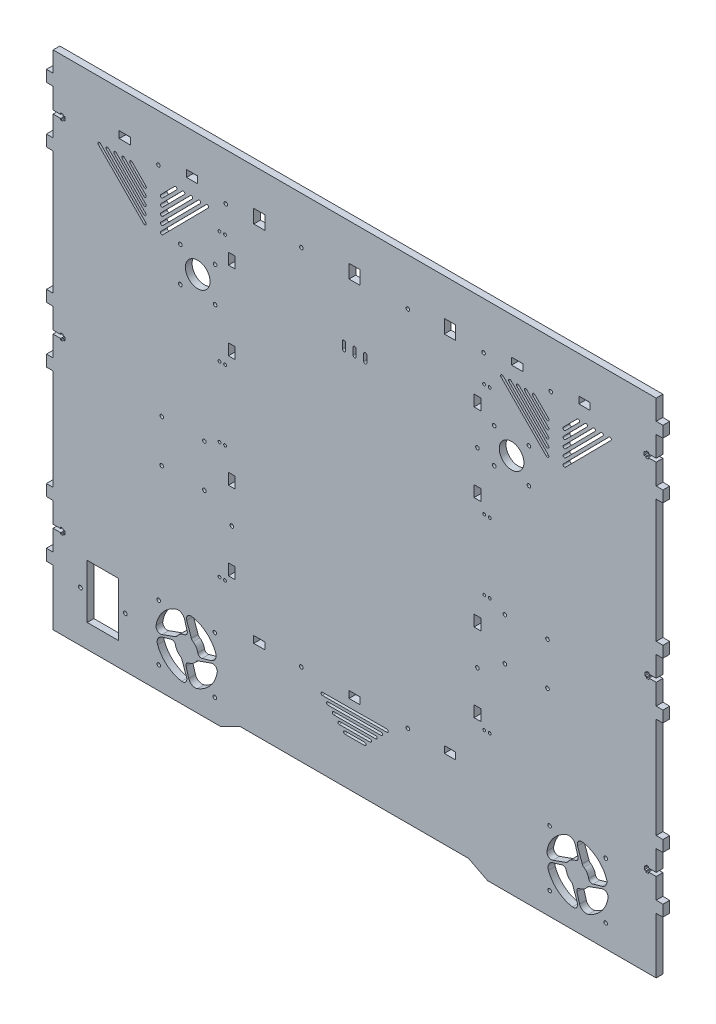
from build123d import *

# Parameters (mm, degrees)
SKETCH_1_R      = 1.6
SKETCH_1_R_2    = 11
SKETCH_1_R_3    = 1.65
SKETCH_1_R_4    = 1.25
SKETCH_1_W      = 10
SKETCH_1_H      = 12.1
SKETCH_1_H_2    = 6.1
SKETCH_1_W_2    = 28.000005
SKETCH_1_H_3    = 48
SKETCH_1_W_3    = 6.1
SKETCH_1_H_4    = 10
EXTRUDE_1_DEPTH = 6


with BuildPart() as part:
    # Эскиз1 → Бобышка-Вытянуть1 (new body)
    with BuildSketch(Plane.XY):
        Polygon((1048.755445299, 42.00723902), (1198.275289364, 42.00723902), (1215.275289364, 50.70723902), (1419.275289364, 50.70723902), (1436.275289364, 42.00723902), (1586.755445299, 42.00723902), (1586.755445299, 42.681206234), (1586.755445299, 91.90723902), (1592.755445299, 92.00723902), (1592.755445299, 102.00723902), (1586.755445299, 102.10723902), (1586.755445299, 120.45723902), (1579.955445299, 120.45723902), (1579.955445299, 119.25723902), (1577.755445299, 119.25723902), (1577.755445299, 120.45723902), (1576.255445299, 120.45723902), (1576.255445299, 123.55723902), (1577.755445299, 123.55723902), (1577.755445299, 124.75723902), (1579.955445299, 124.75723902), (1579.955445299, 123.55723902), (1586.755445299, 123.55723902), (1586.755445299, 141.90723902), (1592.755445299, 142.00723902), (1592.755445299, 152.00723902), (1586.755445299, 152.10723902), (1586.755445299, 241.90723902), (1592.755445299, 242.00723902), (1592.755445299, 252.00723902), (1586.755445299, 252.10723902), (1586.755445299, 270.45723902), (1580.435601234, 270.45723902), (1580.435601234, 269.25723902), (1578.235601234, 269.25723902), (1578.235601234, 270.45723902), (1576.735601234, 270.45723902), (1576.735601234, 273.55723902), (1578.235601234, 273.55723902), (1578.235601234, 274.75723902), (1580.435601234, 274.75723902), (1580.435601234, 273.55723902), (1586.755445299, 273.55723902), (1586.755445299, 291.90723902), (1592.755445298, 292.00723902), (1592.755445298, 302.00723902), (1586.755445298, 302.10723902), (1586.755445298, 411.90723902), (1592.755445297, 412.00723902), (1592.755445297, 422.00723902), (1586.755445299, 422.10723902), (1586.755445299, 440.461521146), (1586.498517724, 440.461521146), (1579.698517724, 440.461521146), (1579.698517724, 439.261521146), (1577.498517724, 439.261521146), (1577.498517724, 440.461521146), (1575.998517724, 440.461521146), (1575.998517724, 443.561521146), (1577.498517724, 443.561521146), (1577.498517724, 444.761521146), (1579.698517724, 444.761521146), (1579.698517724, 443.561521146), (1586.498517724, 443.561521146), (1586.755445299, 443.561521146), (1586.755445299, 461.915803272), (1592.755445296, 462.015803272), (1592.755445296, 472.00723902), (1586.755445299, 472.10723902), (1586.755445299, 490.00723902), (1586.01836179, 490.00723902), (1048.755445299, 490.00723902), (1048.755445299, 477.00723902), (1048.755445299, 472.10723902), (1042.755445299, 472.00723902), (1042.755445299, 462.00723902), (1048.755445299, 461.90723902), (1048.755445299, 443.55723902), (1055.555445299, 443.55723902), (1055.555445299, 444.75723902), (1057.755445299, 444.75723902), (1057.755445299, 443.55723902), (1059.255445299, 443.55723902), (1059.255445299, 440.45723902), (1057.755445299, 440.45723902), (1057.755445299, 439.25723902), (1055.555445299, 439.25723902), (1055.555445299, 440.45723902), (1048.755445299, 440.45723902), (1048.755445299, 422.10723902), (1042.755445299, 422.00723902), (1042.755445299, 412.00723902), (1048.755445299, 411.90723902), (1048.755445299, 302.10723902), (1042.755445299, 302.00723902), (1042.755445299, 292.00723902), (1048.755445299, 291.90723902), (1048.755445299, 273.55723902), (1055.555445299, 273.55723902), (1055.555445299, 274.75723902), (1057.755445299, 274.75723902), (1057.755445299, 273.55723902), (1059.255445299, 273.55723902), (1059.255445299, 270.45723902), (1057.755445299, 270.45723902), (1057.755445299, 269.25723902), (1055.555445299, 269.25723902), (1055.555445299, 270.45723902), (1048.755445299, 270.45723902), (1048.755445299, 252.10723902), (1042.755445299, 252.00723902), (1042.755445299, 242.00723902), (1048.755445299, 241.90723902), (1048.755445299, 152.10723902), (1042.755445299, 152.00723902), (1042.755445299, 142.00723902), (1048.755445299, 141.90723902), (1048.755445299, 123.55723902), (1055.555445299, 123.55723902), (1055.555445299, 124.75723902), (1057.755445299, 124.75723902), (1057.755445299, 123.55723902), (1059.255445299, 123.55723902), (1059.255445299, 120.45723902), (1057.755445299, 120.45723902), (1057.755445299, 119.25723902), (1055.555445299, 119.25723902), (1055.555445299, 120.45723902), (1048.755445299, 120.45723902), (1048.755445299, 102.10723902), (1042.755445299, 102.00723902), (1042.755445299, 92.00723902), (1048.755445299, 91.90723902), (1048.755445299, 42.676924107), align=None)
        with Locations((1193.255445299, 365.50723902)):
            Circle(SKETCH_1_R, mode=Mode.SUBTRACT)
        with Locations((1162.255445299, 365.50723902)):
            Circle(SKETCH_1_R, mode=Mode.SUBTRACT)
        with Locations((1177.755445299, 381.00723902)):
            Circle(SKETCH_1_R_2, mode=Mode.SUBTRACT)
        with Locations((1193.255445299, 396.50723902)):
            Circle(SKETCH_1_R, mode=Mode.SUBTRACT)
        with Locations((1202.755445299, 448.05723902)):
            Circle(SKETCH_1_R, mode=Mode.SUBTRACT)
        with Locations((1432.755445299, 448.05723902)):
            Circle(SKETCH_1_R, mode=Mode.SUBTRACT)
        with Locations((1365.255445299, 448.05723902)):
            Circle(SKETCH_1_R, mode=Mode.SUBTRACT)
        with Locations((1270.255445299, 448.05723902)):
            Circle(SKETCH_1_R, mode=Mode.SUBTRACT)
        with Locations((1162.255445299, 396.50723902)):
            Circle(SKETCH_1_R, mode=Mode.SUBTRACT)
        with Locations((1145.712920123, 217.273882543)):
            Circle(SKETCH_1_R, mode=Mode.SUBTRACT)
        with Locations((1365.255445299, 124.05491402)):
            Circle(SKETCH_1_R, mode=Mode.SUBTRACT)
        with Locations((1270.255445299, 124.05491402)):
            Circle(SKETCH_1_R, mode=Mode.SUBTRACT)
        with Locations((1492.755445299, 448.05723902)):
            Circle(SKETCH_1_R, mode=Mode.SUBTRACT)
        with Locations((1142.755445299, 448.05723902)):
            Circle(SKETCH_1_R, mode=Mode.SUBTRACT)
        with Locations((1073.162844871, 86.87758802)):
            Circle(SKETCH_1_R_3, mode=Mode.SUBTRACT)
        with Locations((1113.162844871, 86.87758802)):
            Circle(SKETCH_1_R_3, mode=Mode.SUBTRACT)
        with Locations((1145.712920123, 255.273882543)):
            Circle(SKETCH_1_R, mode=Mode.SUBTRACT)
        with Locations((1183.712920123, 217.273882543)):
            Circle(SKETCH_1_R, mode=Mode.SUBTRACT)
        with Locations((1183.712920123, 255.273882543)):
            Circle(SKETCH_1_R, mode=Mode.SUBTRACT)
        with Locations((1143.031783229, 112.012971893)):
            Circle(SKETCH_1_R, mode=Mode.SUBTRACT)
        with Locations((1143.031783229, 62.012971893)):
            Circle(SKETCH_1_R, mode=Mode.SUBTRACT)
        with Locations((1541.689341871, 112.012971893)):
            Circle(SKETCH_1_R, mode=Mode.SUBTRACT)
        with Locations((1541.689341871, 62.012971893)):
            Circle(SKETCH_1_R, mode=Mode.SUBTRACT)
        with Locations((1491.689341871, 112.012971893)):
            Circle(SKETCH_1_R, mode=Mode.SUBTRACT)
        with Locations((1491.689341871, 62.012971893)):
            Circle(SKETCH_1_R, mode=Mode.SUBTRACT)
        with Locations((1193.031783229, 62.012971893)):
            Circle(SKETCH_1_R, mode=Mode.SUBTRACT)
        with Locations((1193.031783229, 112.012971893)):
            Circle(SKETCH_1_R, mode=Mode.SUBTRACT)
        with Locations((1427.305445299, 371.90723902)):
            Circle(SKETCH_1_R, mode=Mode.SUBTRACT)
        with Locations((1427.305445299, 201.90723902)):
            Circle(SKETCH_1_R, mode=Mode.SUBTRACT)
        with Locations((1208.205445299, 201.90723902)):
            Circle(SKETCH_1_R, mode=Mode.SUBTRACT)
        with Locations((1202.195892293, 261.19163302)):
            Circle(SKETCH_1_R_4, mode=Mode.SUBTRACT)
        with Locations((1197.224537293, 261.25949102)):
            Circle(SKETCH_1_R_4, mode=Mode.SUBTRACT)
        with Locations((1202.158586293, 156.83802302)):
            Circle(SKETCH_1_R_4, mode=Mode.SUBTRACT)
        with Locations((1197.187231293, 156.90588202)):
            Circle(SKETCH_1_R_4, mode=Mode.SUBTRACT)
        with Locations((1438.308804299, 156.77016502)):
            Circle(SKETCH_1_R_4, mode=Mode.SUBTRACT)
        with Locations((1433.337449299, 156.83802402)):
            Circle(SKETCH_1_R_4, mode=Mode.SUBTRACT)
        with Locations((1473.255445299, 365.50723902)):
            Circle(SKETCH_1_R, mode=Mode.SUBTRACT)
        with Locations((1438.346110299, 261.12377502)):
            Circle(SKETCH_1_R_4, mode=Mode.SUBTRACT)
        with Locations((1442.255445299, 365.50723902)):
            Circle(SKETCH_1_R, mode=Mode.SUBTRACT)
        with Locations((1433.374755299, 261.19163302)):
            Circle(SKETCH_1_R_4, mode=Mode.SUBTRACT)
        with Locations((1442.255445299, 396.50723902)):
            Circle(SKETCH_1_R, mode=Mode.SUBTRACT)
        with Locations((1438.326800299, 323.41350502)):
            Circle(SKETCH_1_R_4, mode=Mode.SUBTRACT)
        with Locations((1457.755445299, 381.00723902)):
            Circle(SKETCH_1_R_2, mode=Mode.SUBTRACT)
        with Locations((1433.355445299, 323.48136302)):
            Circle(SKETCH_1_R_4, mode=Mode.SUBTRACT)
        with Locations((1473.255445299, 396.50723902)):
            Circle(SKETCH_1_R, mode=Mode.SUBTRACT)
        with Locations((1489.797970474, 217.273882543)):
            Circle(SKETCH_1_R, mode=Mode.SUBTRACT)
        with Locations((1451.797970474, 217.273882543)):
            Circle(SKETCH_1_R, mode=Mode.SUBTRACT)
        with Locations((1451.797970474, 255.273882543)):
            Circle(SKETCH_1_R, mode=Mode.SUBTRACT)
        with Locations((1489.797970474, 255.273882543)):
            Circle(SKETCH_1_R, mode=Mode.SUBTRACT)
        with Locations((1438.192072034, 423.931096255)):
            Circle(SKETCH_1_R_4, mode=Mode.SUBTRACT)
        with Locations((1433.220717034, 423.998954255)):
            Circle(SKETCH_1_R_4, mode=Mode.SUBTRACT)
        with Locations((1202.176582293, 323.48136302)):
            Circle(SKETCH_1_R_4, mode=Mode.SUBTRACT)
        with Locations((1197.205227293, 323.54922102)):
            Circle(SKETCH_1_R_4, mode=Mode.SUBTRACT)
        with Locations((1197.167882299, 424.066812255)):
            Circle(SKETCH_1_R_4, mode=Mode.SUBTRACT)
        with Locations((1202.139237299, 423.998954255)):
            Circle(SKETCH_1_R_4, mode=Mode.SUBTRACT)
        with Locations((1402.755445299, 451.05723902)):
            Rectangle(SKETCH_1_W, SKETCH_1_H, mode=Mode.SUBTRACT)
        with BuildLine():
            Line((1503.96657517, 426.229073018), (1516.272389171, 438.671618019))
            ThreePointArc((1516.272389171, 438.671618019), (1518.040128671, 438.681384518), (1518.04989517, 436.913645018))
            Line((1518.04989517, 436.913645018), (1505.744081454, 424.471099305))
            ThreePointArc((1505.744081454, 424.471099305), (1503.976341456, 424.46133302), (1503.96657517, 426.229073018))
        make_face(mode=Mode.SUBTRACT)
        with BuildLine():
            Line((1546.33373517, 437.069909018), (1505.900345932, 396.187259778))
            ThreePointArc((1505.900345932, 396.187259778), (1504.132605931, 396.177493017), (1504.12283917, 397.945233018))
            Line((1504.12283917, 397.945233018), (1544.556229171, 438.827882019))
            ThreePointArc((1544.556229171, 438.827882019), (1546.323968671, 438.837648518), (1546.33373517, 437.069909018))
        make_face(mode=Mode.SUBTRACT)
        with Locations((1232.755445299, 451.05723902)):
            Rectangle(SKETCH_1_W, SKETCH_1_H, mode=Mode.SUBTRACT)
        with Locations((1317.755445299, 451.05723902)):
            Rectangle(SKETCH_1_W, SKETCH_1_H, mode=Mode.SUBTRACT)
        with BuildLine():
            Line((1525.12085517, 436.952711018), (1505.783147441, 417.400139292))
            ThreePointArc((1505.783147441, 417.400139292), (1504.015407443, 417.39037302), (1504.00564117, 419.158113018))
            Line((1504.00564117, 419.158113018), (1523.343349171, 438.710684019))
            ThreePointArc((1523.343349171, 438.710684019), (1525.111088671, 438.720450518), (1525.12085517, 436.952711018))
        make_face(mode=Mode.SUBTRACT)
        with BuildLine():
            Line((1504.08377317, 405.016193018), (1537.485269171, 438.788816019))
            ThreePointArc((1537.485269171, 438.788816019), (1539.253008671, 438.798582518), (1539.26277517, 437.030843018))
            Line((1539.26277517, 437.030843018), (1505.861280197, 403.258219046))
            ThreePointArc((1505.861280197, 403.258219046), (1504.093539698, 403.248452518), (1504.08377317, 405.016193018))
        make_face(mode=Mode.SUBTRACT)
        with Locations((1172.755445299, 454.05723902)):
            Rectangle(SKETCH_1_W, SKETCH_1_H_2, mode=Mode.SUBTRACT)
        with BuildLine():
            Line((1532.19181517, 436.991777018), (1505.822213435, 410.329179286))
            ThreePointArc((1505.822213435, 410.329179286), (1504.054473437, 410.31941302), (1504.04470717, 412.087153018))
            Line((1504.04470717, 412.087153018), (1530.414309171, 438.749750019))
            ThreePointArc((1530.414309171, 438.749750019), (1532.182048671, 438.759516518), (1532.19181517, 436.991777018))
        make_face(mode=Mode.SUBTRACT)
        with Locations((1462.755445299, 454.05723902)):
            Rectangle(SKETCH_1_W, SKETCH_1_H_2, mode=Mode.SUBTRACT)
        with BuildLine():
            Line((1131.388051427, 397.945233018), (1090.954661426, 438.827882019))
            ThreePointArc((1090.954661426, 438.827882019), (1089.186921926, 438.837648518), (1089.177155427, 437.069909018))
            Line((1089.177155427, 437.069909018), (1129.610544665, 396.187259778))
            ThreePointArc((1129.610544665, 396.187259778), (1131.378284666, 396.177493017), (1131.388051427, 397.945233018))
        make_face(mode=Mode.SUBTRACT)
        with BuildLine():
            Line((1096.248115427, 437.030843018), (1129.6496104, 403.258219046))
            ThreePointArc((1129.6496104, 403.258219046), (1131.417350899, 403.248452518), (1131.427117427, 405.016193018))
            Line((1131.427117427, 405.016193018), (1098.025621426, 438.788816019))
            ThreePointArc((1098.025621426, 438.788816019), (1096.257881926, 438.798582518), (1096.248115427, 437.030843018))
        make_face(mode=Mode.SUBTRACT)
        with BuildLine():
            Line((1131.466183427, 412.087153018), (1105.096581426, 438.749750019))
            ThreePointArc((1105.096581426, 438.749750019), (1103.328841926, 438.759516518), (1103.319075427, 436.991777018))
            Line((1103.319075427, 436.991777018), (1129.688677162, 410.329179286))
            ThreePointArc((1129.688677162, 410.329179286), (1131.45641716, 410.31941302), (1131.466183427, 412.087153018))
        make_face(mode=Mode.SUBTRACT)
        with BuildLine():
            Line((1131.505249427, 419.158113018), (1112.167541426, 438.710684019))
            ThreePointArc((1112.167541426, 438.710684019), (1110.399801926, 438.720450518), (1110.390035427, 436.952711018))
            Line((1110.390035427, 436.952711018), (1129.727743156, 417.400139292))
            ThreePointArc((1129.727743156, 417.400139292), (1131.495483154, 417.39037302), (1131.505249427, 419.158113018))
        make_face(mode=Mode.SUBTRACT)
        with BuildLine():
            Line((1131.544315427, 426.229073018), (1119.238501426, 438.671618019))
            ThreePointArc((1119.238501426, 438.671618019), (1117.470761926, 438.681384518), (1117.460995427, 436.913645018))
            Line((1117.460995427, 436.913645018), (1129.766809143, 424.471099305))
            ThreePointArc((1129.766809143, 424.471099305), (1131.534549141, 424.46133302), (1131.544315427, 426.229073018))
        make_face(mode=Mode.SUBTRACT)
        with BuildLine():
            Line((1144.920952759, 397.945233486), (1185.354342039, 438.827882757))
            ThreePointArc((1185.354342039, 438.827882757), (1187.122082038, 438.837649018), (1187.131848299, 437.06990902))
            Line((1187.131848299, 437.06990902), (1146.698459299, 396.18726002))
            ThreePointArc((1146.698459299, 396.18726002), (1144.930719296, 396.177493483), (1144.920952759, 397.945233486))
        make_face(mode=Mode.SUBTRACT)
        with Locations((1402.755445299, 124.05491402)):
            Rectangle(SKETCH_1_W, SKETCH_1_H_2, mode=Mode.SUBTRACT)
        with Locations((1317.755445299, 124.05491402)):
            Rectangle(SKETCH_1_W, SKETCH_1_H_2, mode=Mode.SUBTRACT)
        with Locations((1232.755445299, 124.05491402)):
            Rectangle(SKETCH_1_W, SKETCH_1_H_2, mode=Mode.SUBTRACT)
        with Locations((1093.162846371, 86.87758802)):
            Rectangle(SKETCH_1_W_2, SKETCH_1_H_3, mode=Mode.SUBTRACT)
        with BuildLine():
            Line((1455.450001299, 437.03084302), (1488.851497299, 403.25822002))
            ThreePointArc((1488.851497299, 403.25822002), (1490.619237301, 403.248453504), (1490.629003817, 405.016193507))
            Line((1490.629003817, 405.016193507), (1457.22750805, 438.788816271))
            ThreePointArc((1457.22750805, 438.788816271), (1455.459768049, 438.798583021), (1455.450001299, 437.03084302))
        make_face(mode=Mode.SUBTRACT)
        with BuildLine():
            Line((1144.88188678, 405.016193507), (1178.283382547, 438.788816271))
            ThreePointArc((1178.283382547, 438.788816271), (1180.051122548, 438.798583021), (1180.060889299, 437.03084302))
            Line((1180.060889299, 437.03084302), (1146.659393299, 403.25822002))
            ThreePointArc((1146.659393299, 403.25822002), (1144.891653296, 403.248453504), (1144.88188678, 405.016193507))
        make_face(mode=Mode.SUBTRACT)
        with BuildLine():
            Line((1172.989929299, 436.99177702), (1146.620327299, 410.32917902))
            ThreePointArc((1146.620327299, 410.32917902), (1144.852586799, 410.319412517), (1144.842820296, 412.087153017))
            Line((1144.842820296, 412.087153017), (1171.212422547, 438.749750271))
            ThreePointArc((1171.212422547, 438.749750271), (1172.980162548, 438.759517021), (1172.989929299, 436.99177702))
        make_face(mode=Mode.SUBTRACT)
        with BuildLine():
            Line((1144.803754296, 419.158113017), (1164.141462547, 438.710684271))
            ThreePointArc((1164.141462547, 438.710684271), (1165.909202548, 438.720451021), (1165.918969299, 436.95271102))
            Line((1165.918969299, 436.95271102), (1146.581261299, 417.40013902))
            ThreePointArc((1146.581261299, 417.40013902), (1144.813520799, 417.390372517), (1144.803754296, 419.158113017))
        make_face(mode=Mode.SUBTRACT)
        with BuildLine():
            Line((1158.848009299, 436.91364502), (1146.542195299, 424.47109902))
            ThreePointArc((1146.542195299, 424.47109902), (1144.774454799, 424.461332517), (1144.764688295, 426.229073017))
            Line((1144.764688295, 426.229073017), (1157.070502547, 438.671618271))
            ThreePointArc((1157.070502547, 438.671618271), (1158.838242548, 438.681385021), (1158.848009299, 436.91364502))
        make_face(mode=Mode.SUBTRACT)
        with BuildLine():
            Line((1326.629180083, 91.617684324), (1309.129447611, 91.521000907))
            ThreePointArc((1309.129447611, 91.521000907), (1307.872560358, 92.764075536), (1309.115634987, 94.020962789))
            Line((1309.115634987, 94.020962789), (1326.615368167, 94.1176455))
            ThreePointArc((1326.615368167, 94.1176455), (1327.872254713, 92.87457087), (1326.629180083, 91.617684324))
        make_face(mode=Mode.SUBTRACT)
        with BuildLine():
            Line((1331.601480015, 96.645231923), (1304.101899305, 96.493300132))
            ThreePointArc((1304.101899305, 96.493300132), (1302.845012759, 97.736375468), (1304.088088096, 98.993262014))
            Line((1304.088088096, 98.993262014), (1331.587668099, 99.145193099))
            ThreePointArc((1331.587668099, 99.145193099), (1332.844554645, 97.902118469), (1331.601480015, 96.645231923))
        make_face(mode=Mode.SUBTRACT)
        with BuildLine():
            Line((1336.573779947, 101.672779522), (1299.074351706, 101.465600064))
            ThreePointArc((1299.074351706, 101.465600064), (1297.81746516, 102.7086754), (1299.060540497, 103.965561946))
            Line((1299.060540497, 103.965561946), (1336.559967324, 104.172741405))
            ThreePointArc((1336.559967324, 104.172741405), (1337.816854577, 102.929666775), (1336.573779947, 101.672779522))
        make_face(mode=Mode.SUBTRACT)
        with BuildLine():
            Line((1289.005445299, 113.91016181), (1346.504567188, 114.227836603))
            ThreePointArc((1346.504567188, 114.227836603), (1347.761454441, 112.984761973), (1346.518379811, 111.72787472))
            Line((1346.518379811, 111.72787472), (1289.019256508, 111.410199928))
            ThreePointArc((1289.019256508, 111.410199928), (1287.762369962, 112.653275264), (1289.005445299, 113.91016181))
        make_face(mode=Mode.SUBTRACT)
        with BuildLine():
            Line((1341.546079879, 106.700327121), (1294.046804107, 106.437899996))
            ThreePointArc((1294.046804107, 106.437899996), (1292.789917561, 107.680975332), (1294.032992898, 108.937861878))
            Line((1294.032992898, 108.937861878), (1341.532267256, 109.200289004))
            ThreePointArc((1341.532267256, 109.200289004), (1342.789154509, 107.957214374), (1341.546079879, 106.700327121))
        make_face(mode=Mode.SUBTRACT)
        with BuildLine():
            Line((1448.379042299, 437.06990902), (1488.812431299, 396.18726002))
            ThreePointArc((1488.812431299, 396.18726002), (1490.580171301, 396.177493483), (1490.589937838, 397.945233486))
            Line((1490.589937838, 397.945233486), (1450.156548558, 438.827882757))
            ThreePointArc((1450.156548558, 438.827882757), (1448.388808559, 438.837649018), (1448.379042299, 437.06990902))
        make_face(mode=Mode.SUBTRACT)
        with BuildLine():
            Line((1469.591921299, 436.95271102), (1488.929629299, 417.40013902))
            ThreePointArc((1488.929629299, 417.40013902), (1490.697369798, 417.390372517), (1490.707136301, 419.158113017))
            Line((1490.707136301, 419.158113017), (1471.36942805, 438.710684271))
            ThreePointArc((1471.36942805, 438.710684271), (1469.601688049, 438.720451021), (1469.591921299, 436.95271102))
        make_face(mode=Mode.SUBTRACT)
        with BuildLine():
            Line((1476.662881299, 436.91364502), (1488.968695299, 424.47109902))
            ThreePointArc((1488.968695299, 424.47109902), (1490.736435798, 424.461332517), (1490.746202302, 426.229073017))
            Line((1490.746202302, 426.229073017), (1478.44038805, 438.671618271))
            ThreePointArc((1478.44038805, 438.671618271), (1476.672648049, 438.681385021), (1476.662881299, 436.91364502))
        make_face(mode=Mode.SUBTRACT)
        with BuildLine():
            Line((1462.520961299, 436.99177702), (1488.890563299, 410.32917902))
            ThreePointArc((1488.890563299, 410.32917902), (1490.658303798, 410.319412517), (1490.668070301, 412.087153017))
            Line((1490.668070301, 412.087153017), (1464.29846805, 438.749750271))
            ThreePointArc((1464.29846805, 438.749750271), (1462.530728049, 438.759517021), (1462.520961299, 436.99177702))
        make_face(mode=Mode.SUBTRACT)
        with BuildLine():
            Line((1530.317428095, 86.376861737), (1538.475232454, 88.733710728))
            ThreePointArc((1538.475232454, 88.733710728), (1542.17332586, 91.808427073), (1542.425449513, 96.611156411))
            ThreePointArc((1542.425449513, 96.611156411), (1534.073793622, 108.256420171), (1521.01322148, 114.154197673))
            ThreePointArc((1521.01322148, 114.154197673), (1517.29590567, 112.767766584), (1516.60124357, 108.861608297))
            Line((1516.60124357, 108.861608297), (1520.758003302, 97.218443933))
            ThreePointArc((1520.758003302, 97.218443933), (1521.358855676, 96.119028752), (1522.270346342, 95.259422982))
            ThreePointArc((1522.270346342, 95.259422982), (1525.056734388, 92.412613), (1526.534776336, 88.713467502))
            ThreePointArc((1526.534776336, 88.713467502), (1527.908153618, 86.706675217), (1530.317428095, 86.376861737))
        make_face(mode=Mode.SUBTRACT)
        with BuildLine():
            Line((1494.55707538, 86.909353323), (1506.20023984, 91.066114192))
            ThreePointArc((1506.20023984, 91.066114192), (1507.29965486, 91.666966573), (1508.159260507, 92.578457166))
            ThreePointArc((1508.159260507, 92.578457166), (1511.006070681, 95.364845404), (1514.70521647, 96.842887354))
            ThreePointArc((1514.70521647, 96.842887354), (1516.712008813, 98.216264561), (1517.041822384, 100.625539031))
            Line((1517.041822384, 100.625539031), (1514.684973929, 108.783342647))
            ThreePointArc((1514.684973929, 108.783342647), (1511.610257778, 112.481436135), (1506.807528513, 112.73356004))
            ThreePointArc((1506.807528513, 112.73356004), (1495.162263635, 104.381904059), (1489.264485679, 91.321331066))
            ThreePointArc((1489.264485679, 91.321331066), (1490.650916926, 87.604015185), (1494.55707538, 86.909353323))
        make_face(mode=Mode.SUBTRACT)
        with BuildLine():
            Line((1502.766409655, 87.3542366), (1494.608606517, 84.997388283))
            ThreePointArc((1494.608606517, 84.997388283), (1490.910512973, 81.92267202), (1490.658389213, 77.119942632))
            ThreePointArc((1490.658389213, 77.119942632), (1499.010045139, 65.474678548), (1512.070617536, 59.576900922))
            ThreePointArc((1512.070617536, 59.576900922), (1515.787933469, 60.963332183), (1516.482595285, 64.869490698))
            Line((1516.482595285, 64.869490698), (1512.325834508, 76.512654108))
            ThreePointArc((1512.325834508, 76.512654108), (1511.724982125, 77.612069087), (1510.813491551, 78.471674702))
            ThreePointArc((1510.813491551, 78.471674702), (1508.027103292, 81.318484881), (1506.549061331, 85.017630686))
            ThreePointArc((1506.549061331, 85.017630686), (1505.175684124, 87.024423029), (1502.766409655, 87.3542366))
        make_face(mode=Mode.SUBTRACT)
        with BuildLine():
            Line((1538.537978168, 86.806225385), (1526.894813708, 82.649464517))
            ThreePointArc((1526.894813708, 82.649464517), (1525.795398688, 82.048612136), (1524.935793041, 81.137121543))
            ThreePointArc((1524.935793041, 81.137121543), (1522.088983162, 78.350733496), (1518.389837768, 76.872691482))
            ThreePointArc((1518.389837768, 76.872691482), (1516.383045574, 75.499314225), (1516.053232058, 73.090039843))
            Line((1516.053232058, 73.090039843), (1518.410080468, 64.932236381))
            ThreePointArc((1518.410080468, 64.932236381), (1521.484796731, 61.234142837), (1526.287526119, 60.982019077))
            ThreePointArc((1526.287526119, 60.982019077), (1537.932790281, 69.333675098), (1543.830567869, 82.394247642))
            ThreePointArc((1543.830567869, 82.394247642), (1542.444136622, 86.111563523), (1538.537978168, 86.806225385))
        make_face(mode=Mode.SUBTRACT)
        with Locations((1522.755445299, 454.05723902)):
            Rectangle(SKETCH_1_W, SKETCH_1_H_2, mode=Mode.SUBTRACT)
        with Locations((1112.755445299, 454.05723902)):
            Rectangle(SKETCH_1_W, SKETCH_1_H_2, mode=Mode.SUBTRACT)
        with BuildLine():
            Line((1167.825036644, 64.869490698), (1163.668275867, 76.512654108))
            ThreePointArc((1163.668275867, 76.512654108), (1163.067423484, 77.612069087), (1162.155932909, 78.471674702))
            ThreePointArc((1162.155932909, 78.471674702), (1159.36954465, 81.318484881), (1157.89150269, 85.017630686))
            ThreePointArc((1157.89150269, 85.017630686), (1156.518125483, 87.024423029), (1154.108851013, 87.3542366))
            Line((1154.108851013, 87.3542366), (1145.951047876, 84.997388283))
            ThreePointArc((1145.951047876, 84.997388283), (1142.252954332, 81.92267202), (1142.000830572, 77.119942632))
            ThreePointArc((1142.000830572, 77.119942632), (1150.352486498, 65.474678548), (1163.413058895, 59.576900922))
            ThreePointArc((1163.413058895, 59.576900922), (1167.130374827, 60.963332183), (1167.825036644, 64.869490698))
        make_face(mode=Mode.SUBTRACT)
        with Locations((1427.305445299, 406.90723902)):
            Rectangle(SKETCH_1_W_3, SKETCH_1_H_4, mode=Mode.SUBTRACT)
        with Locations((1427.305445299, 336.90723902)):
            Rectangle(SKETCH_1_W_3, SKETCH_1_H_4, mode=Mode.SUBTRACT)
        with Locations((1427.305445299, 236.90723902)):
            Rectangle(SKETCH_1_W_3, SKETCH_1_H_4, mode=Mode.SUBTRACT)
        with Locations((1427.305445299, 166.90723902)):
            Rectangle(SKETCH_1_W_3, SKETCH_1_H_4, mode=Mode.SUBTRACT)
        with Locations((1208.205445299, 166.90723902)):
            Rectangle(SKETCH_1_W_3, SKETCH_1_H_4, mode=Mode.SUBTRACT)
        with Locations((1208.205445299, 236.90723902)):
            Rectangle(SKETCH_1_W_3, SKETCH_1_H_4, mode=Mode.SUBTRACT)
        with Locations((1208.205445299, 336.90723902)):
            Rectangle(SKETCH_1_W_3, SKETCH_1_H_4, mode=Mode.SUBTRACT)
        with Locations((1208.205445299, 406.90723902)):
            Rectangle(SKETCH_1_W_3, SKETCH_1_H_4, mode=Mode.SUBTRACT)
        with BuildLine():
            Line((1145.899516738, 86.909353323), (1157.542681199, 91.066114192))
            ThreePointArc((1157.542681199, 91.066114192), (1158.642096219, 91.666966573), (1159.501701866, 92.578457166))
            ThreePointArc((1159.501701866, 92.578457166), (1162.348512039, 95.364845404), (1166.047657828, 96.842887354))
            ThreePointArc((1166.047657828, 96.842887354), (1168.054450172, 98.216264561), (1168.384263743, 100.625539031))
            Line((1168.384263743, 100.625539031), (1166.027415288, 108.783342647))
            ThreePointArc((1166.027415288, 108.783342647), (1162.952699137, 112.481436135), (1158.149969872, 112.73356004))
            ThreePointArc((1158.149969872, 112.73356004), (1146.504704993, 104.381904059), (1140.606927038, 91.321331066))
            ThreePointArc((1140.606927038, 91.321331066), (1141.993358285, 87.604015185), (1145.899516738, 86.909353323))
        make_face(mode=Mode.SUBTRACT)
        with BuildLine():
            Line((1189.880419527, 86.806225385), (1178.237255066, 82.649464517))
            ThreePointArc((1178.237255066, 82.649464517), (1177.137840046, 82.048612136), (1176.2782344, 81.137121543))
            ThreePointArc((1176.2782344, 81.137121543), (1173.43142452, 78.350733496), (1169.732279127, 76.872691482))
            ThreePointArc((1169.732279127, 76.872691482), (1167.725486933, 75.499314225), (1167.395673416, 73.090039843))
            Line((1167.395673416, 73.090039843), (1169.752521827, 64.932236381))
            ThreePointArc((1169.752521827, 64.932236381), (1172.82723809, 61.234142837), (1177.629967478, 60.982019077))
            ThreePointArc((1177.629967478, 60.982019077), (1189.275231639, 69.333675098), (1195.173009228, 82.394247642))
            ThreePointArc((1195.173009228, 82.394247642), (1193.78657798, 86.111563523), (1189.880419527, 86.806225385))
        make_face(mode=Mode.SUBTRACT)
        with BuildLine():
            Line((1181.659869454, 86.376861737), (1189.817673812, 88.733710728))
            ThreePointArc((1189.817673812, 88.733710728), (1193.515767218, 91.808427073), (1193.767890872, 96.611156411))
            ThreePointArc((1193.767890872, 96.611156411), (1185.416234981, 108.256420171), (1172.355662838, 114.154197673))
            ThreePointArc((1172.355662838, 114.154197673), (1168.638347028, 112.767766584), (1167.943684929, 108.861608297))
            Line((1167.943684929, 108.861608297), (1172.100444661, 97.218443933))
            ThreePointArc((1172.100444661, 97.218443933), (1172.701297034, 96.119028752), (1173.6127877, 95.259422982))
            ThreePointArc((1173.6127877, 95.259422982), (1176.399175747, 92.412613), (1177.877217694, 88.713467502))
            ThreePointArc((1177.877217694, 88.713467502), (1179.250594977, 86.706675217), (1181.659869454, 86.376861737))
        make_face(mode=Mode.SUBTRACT)
        with BuildLine():
            Line((1325.855445299, 394.044239538), (1325.855445299, 388.044239538))
            ThreePointArc((1325.855445299, 388.044239538), (1327.255445299, 386.644239538), (1328.655445299, 388.044239538))
            Line((1328.655445299, 388.044239538), (1328.655445299, 394.044239538))
            ThreePointArc((1328.655445299, 394.044239538), (1327.255445299, 395.444239538), (1325.855445299, 394.044239538))
        make_face(mode=Mode.SUBTRACT)
        with BuildLine():
            Line((1316.355445299, 394.044239538), (1316.355445299, 388.044239538))
            ThreePointArc((1316.355445299, 388.044239538), (1317.755445299, 386.644239538), (1319.155445299, 388.044239538))
            Line((1319.155445299, 388.044239538), (1319.155445299, 394.044239538))
            ThreePointArc((1319.155445299, 394.044239538), (1317.755445299, 395.444239538), (1316.355445299, 394.044239538))
        make_face(mode=Mode.SUBTRACT)
        with BuildLine():
            Line((1306.855445299, 394.044239538), (1306.855445299, 388.044239538))
            ThreePointArc((1306.855445299, 388.044239538), (1308.255445299, 386.644239538), (1309.655445299, 388.044239538))
            Line((1309.655445299, 388.044239538), (1309.655445299, 394.044239538))
            ThreePointArc((1309.655445299, 394.044239538), (1308.255445299, 395.444239538), (1306.855445299, 394.044239538))
        make_face(mode=Mode.SUBTRACT)
    extrude(amount=-EXTRUDE_1_DEPTH)


solid = part.part
